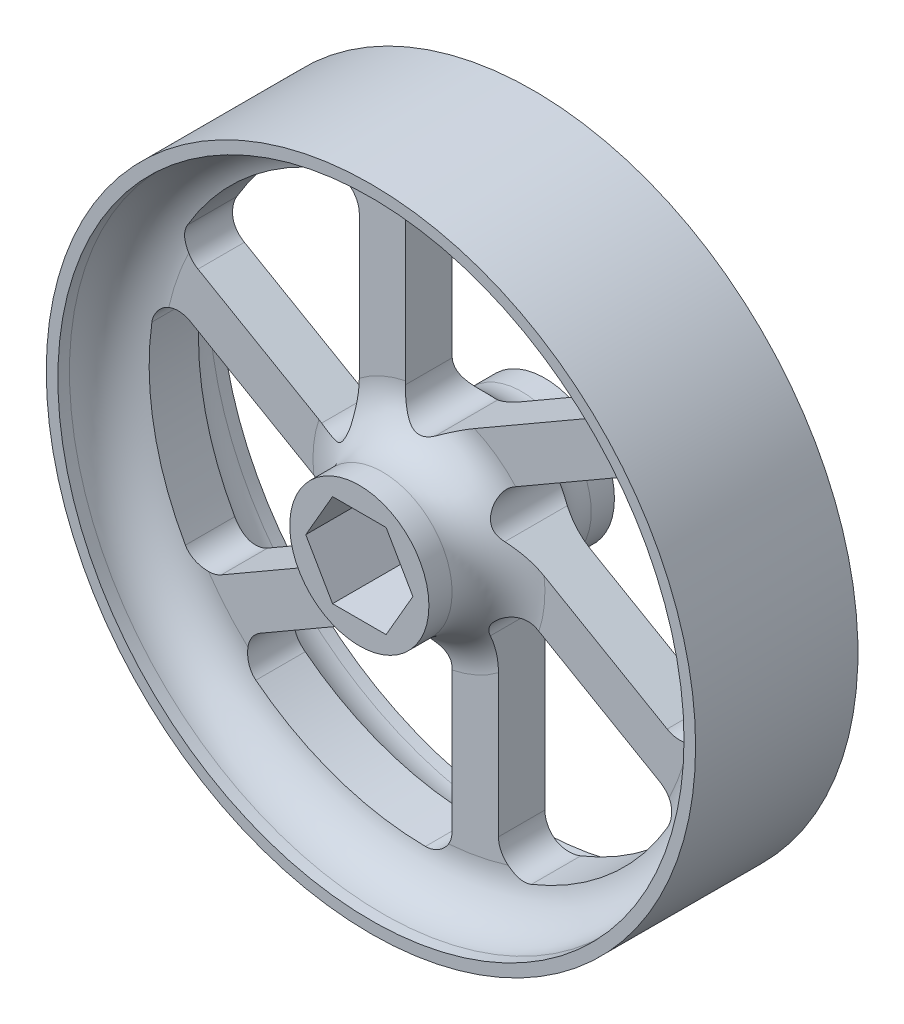
from build123d import *

# Parameters (mm, degrees)
SKETCH1_R           = 44.45
BOSS_EXTRUDE1_DEPTH = 12.7
SKETCH3_OUTSIDE_W   = 116.552
SKETCH3_OUTSIDE_H   = 116.552
SKETCH3_OUTSIDE_R   = 27.132432737
CUT_EXTRUDE1_DEPTH  = 1.5875
CUT_EXTRUDE2_DEPTH  = 65.835334695
CIRPATTERN1_COUNT   = 6


with BuildPart() as part:
    # Sketch1 → Boss-Extrude1 (new, symmetric)
    with BuildSketch(Plane.XY):
        Circle(SKETCH1_R)
        Polygon((3.666174209, -6.35), (7.332348419, 0), (3.666174209, 6.35), (-3.666174209, 6.35), (-7.332348419, 0), (-3.666174209, -6.35), align=None, mode=Mode.SUBTRACT)
    extrude(amount=BOSS_EXTRUDE1_DEPTH, both=True)

    # Sketch2 → Cut-Revolve1 (revolve, cut)
    with BuildSketch(Plane(origin=(0, 0, 0), x_dir=(1, 0, 0), z_dir=(0, 1, 0))):
        with BuildLine():
            Line((-36.5125, 3.175), (-15.875, 3.175))
            ThreePointArc((-15.875, 3.175), (-11.384871939, 5.034871939), (-9.525, 9.525))
            Line((-9.525, 9.525), (-9.525, 12.7))
            Line((-9.525, 12.7), (-42.8625, 12.7))
            Line((-42.8625, 12.7), (-42.8625, 9.525))
            ThreePointArc((-42.8625, 9.525), (-41.002628061, 5.034871939), (-36.5125, 3.175))
        make_face()
    cut_revolve1 = revolve(axis=Axis((0, 0, 1000), (0, 0, -1)), mode=Mode.SUBTRACT)

    # Mirror1: Cut-Revolve1 across plane
    add(cut_revolve1.mirror(Plane.XY), mode=Mode.SUBTRACT)

    # Sketch3 outside → Cut-Extrude1 (cut)
    with BuildSketch(Plane.XY.offset(12.7)):
        Rectangle(SKETCH3_OUTSIDE_W, SKETCH3_OUTSIDE_H)
        Circle(SKETCH3_OUTSIDE_R, mode=Mode.SUBTRACT)
    cut_extrude1 = extrude(amount=-CUT_EXTRUDE1_DEPTH, mode=Mode.SUBTRACT)

    # Mirror2: Cut-Extrude1 across plane
    add(cut_extrude1.mirror(Plane.XY), mode=Mode.SUBTRACT)

    # Sketch4 → Cut-Extrude2 (cut, symmetric)
    with BuildSketch(Plane.XY.offset(3.175)):
        with BuildLine():
            Line((-3.175, 15.104637743), (-3.175, 34.670069585))
            ThreePointArc((-3.175, 34.670069585), (-2.161771254, 37.103604102), (0.279120879, 38.098977565))
            ThreePointArc((0.279120879, 38.098977565), (12.555033829, 35.971949149), (23.488422901, 29.998399784))
            ThreePointArc((23.488422901, 29.998399784), (24.794985079, 27.057541118), (23.08896484, 24.328942694))
            Line((23.08896484, 24.328942694), (1.9685, 12.135036633))
            ThreePointArc((1.9685, 12.135036633), (-1.4605, 12.135036633), (-3.175, 15.104637743))
        make_face()
    cut_extrude2 = extrude(amount=CUT_EXTRUDE2_DEPTH, both=True, mode=Mode.SUBTRACT)

    # CirPattern1: Cut-Extrude2 ×6 about axis
    cirpattern1_axis = Axis((0, 0, -1000), (0, 0, -1))
    for i in range(1, CIRPATTERN1_COUNT):
        add(cut_extrude2.rotate(cirpattern1_axis, i * 360 / CIRPATTERN1_COUNT), mode=Mode.SUBTRACT)


solid = part.part
